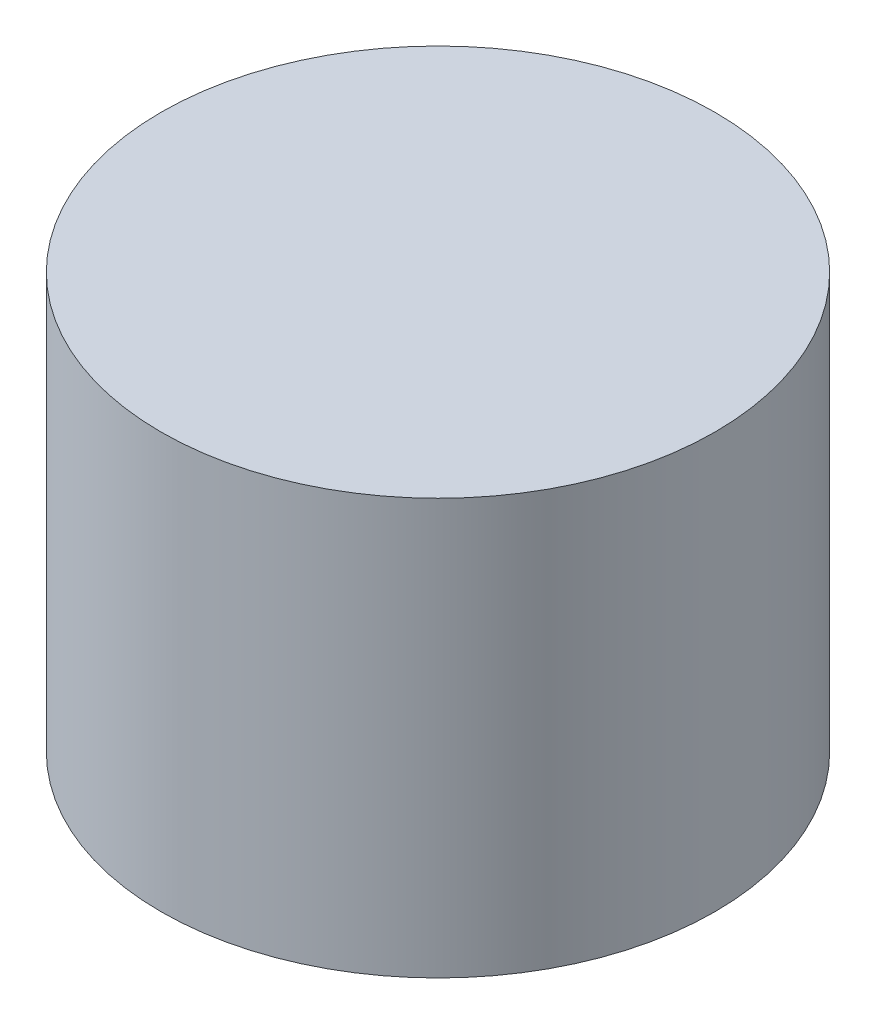
from build123d import *

# Parameters (mm, degrees)
SKETCH1_R           = 6.35
BOSS_EXTRUDE1_DEPTH = 9.525


with BuildPart() as part:
    # Sketch1 → Boss-Extrude1 (new body)
    with BuildSketch(Plane(origin=(0, 0, 0), x_dir=(1, 0, 0), z_dir=(0, 1, 0))):
        Circle(SKETCH1_R)
    extrude(amount=BOSS_EXTRUDE1_DEPTH)


solid = part.part
